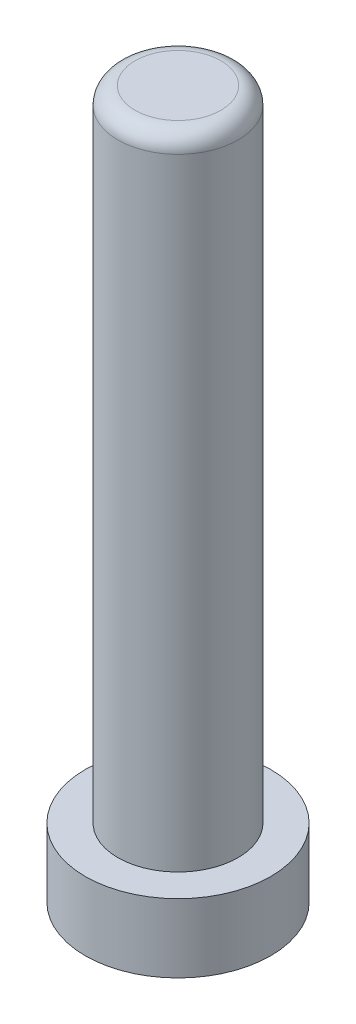
from build123d import *

# Parameters (mm, degrees)
SKETCH1_R           = 2.7
BOSS_EXTRUDE1_DEPTH = 2
SKETCH3_R           = 0.95
CUT_EXTRUDE2_DEPTH  = 9.5
SKETCH2_R           = 1.75
BOSS_EXTRUDE2_DEPTH = 18.6
SKETCH7_R           = 1.2
CUT_EXTRUDE4_DEPTH  = 2.8
FILLET2_R           = 0.5
SKETCH8_R           = 0.95
CUT_EXTRUDE5_DEPTH  = 9.5


with BuildPart() as part:
    # Sketch1 → Boss-Extrude1 (new body)
    with BuildSketch(Plane(origin=(0, 0, 0), x_dir=(1, 0, 0), z_dir=(0, 1, 0))):
        Circle(SKETCH1_R)
    extrude(amount=BOSS_EXTRUDE1_DEPTH)

    # Sketch3 → Cut-Extrude2 (cut)
    with BuildSketch(Plane.XZ):
        Circle(SKETCH3_R)
    extrude(amount=-CUT_EXTRUDE2_DEPTH, mode=Mode.SUBTRACT)

    # Sketch2 → Boss-Extrude2 (add)
    with BuildSketch(Plane(origin=(0, 2, 0), x_dir=(1, 0, 0), z_dir=(0, 1, 0))):
        Circle(SKETCH2_R)
    extrude(amount=BOSS_EXTRUDE2_DEPTH)

    # Sketch7 → Cut-Extrude4 (cut)
    with BuildSketch(Plane.XZ):
        Circle(SKETCH7_R)
    extrude(amount=-CUT_EXTRUDE4_DEPTH, mode=Mode.SUBTRACT)

    # Fillet2
    fillet2_edges = [part.edges().sort_by_distance(p)[0] for p in [
        (-1.75, 20.6, 0),
    ]]
    fillet(fillet2_edges, radius=FILLET2_R)

    # Sketch8 → Cut-Extrude5 (cut)
    with BuildSketch(Plane.XZ):
        Circle(SKETCH8_R)
    extrude(amount=-CUT_EXTRUDE5_DEPTH, mode=Mode.SUBTRACT)


solid = part.part
